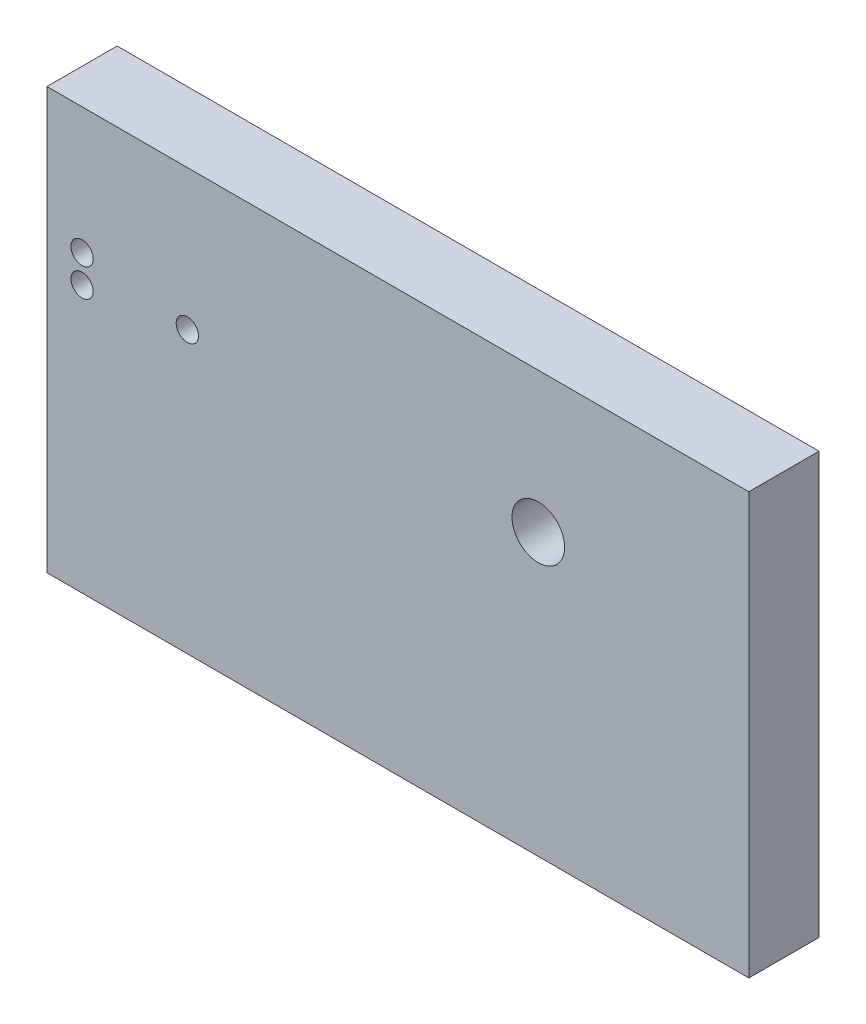
from build123d import *

# Parameters (mm, degrees)
SKETCH1_W                       = 127
SKETCH1_H                       = 76.2
BOSS_EXTRUDE1_DEPTH             = 12.7
F_1_32_0_159_DIAMETER_HOLE1_D   = 4.0386
F_10_32_TAPPED_HOLE1_D          = 4.0386
F_10_32_TAPPED_HOLE1_DEPTH      = 12.7
F_10_32_TAPPED_HOLE1_TIP        = 1.213317848
F_3_8_0_375_DIAMETER_HOLE1_D    = 9.525
F_10_32_TAPPED_HOLE2_D          = 4.0386
F_10_32_TAPPED_HOLE2_DEPTH      = 14.478
F_10_32_TAPPED_HOLE2_TIP        = 1.213317848
F_21_0_159_DIAMETER_HOLE1_D     = 4.0386
F_21_0_159_DIAMETER_HOLE1_DEPTH = 14.478
F_21_0_159_DIAMETER_HOLE1_TIP   = 1.213317848


with BuildPart() as part:
    # Sketch1 → Boss-Extrude1 (new body)
    with BuildSketch(Plane.XY):
        with Locations((63.5, 38.1)):
            Rectangle(SKETCH1_W, SKETCH1_H)
    extrude(amount=BOSS_EXTRUDE1_DEPTH)

    # 1/32 (0.159) Diameter Hole1 (through all)
    with Locations(Plane.XY.offset(12.7)):
        with Locations((25.4, 50.8)):
            Hole(F_1_32_0_159_DIAMETER_HOLE1_D / 2)

    # #10-32 Tapped Hole1
    with Locations(Plane(origin=(0, 0, 0), x_dir=(-1, 0, 0), z_dir=(0, -1, 0))):
        with Locations((-19.05, -6.35), (-107.95, -6.35)):
            Hole(F_10_32_TAPPED_HOLE1_D / 2, depth=F_10_32_TAPPED_HOLE1_DEPTH)
            with Locations((0, 0, -(F_10_32_TAPPED_HOLE1_DEPTH + F_10_32_TAPPED_HOLE1_TIP / 2))):  # 118° drill point
                Cone(0, F_10_32_TAPPED_HOLE1_D / 2, F_10_32_TAPPED_HOLE1_TIP, mode=Mode.SUBTRACT)

    # 3/8 (0.375) Diameter Hole1 (through all)
    with Locations(Plane.XY.offset(12.7)):
        with Locations((88.9, 50.8)):
            Hole(F_3_8_0_375_DIAMETER_HOLE1_D / 2)

    # #10-32 Tapped Hole2
    with Locations(Plane.XY.offset(12.7)):
        with Locations((6.35, 48.26)):
            Hole(F_10_32_TAPPED_HOLE2_D / 2, depth=F_10_32_TAPPED_HOLE2_DEPTH)
            with Locations((0, 0, -(F_10_32_TAPPED_HOLE2_DEPTH + F_10_32_TAPPED_HOLE2_TIP / 2))):  # 118° drill point
                Cone(0, F_10_32_TAPPED_HOLE2_D / 2, F_10_32_TAPPED_HOLE2_TIP, mode=Mode.SUBTRACT)

    # #21 (0.159) Diameter Hole1
    with Locations(Plane.XY.offset(12.7)):
        with Locations((6.35, 53.34)):
            Hole(F_21_0_159_DIAMETER_HOLE1_D / 2, depth=F_21_0_159_DIAMETER_HOLE1_DEPTH)
            with Locations((0, 0, -(F_21_0_159_DIAMETER_HOLE1_DEPTH + F_21_0_159_DIAMETER_HOLE1_TIP / 2))):  # 118° drill point
                Cone(0, F_21_0_159_DIAMETER_HOLE1_D / 2, F_21_0_159_DIAMETER_HOLE1_TIP, mode=Mode.SUBTRACT)


solid = part.part
